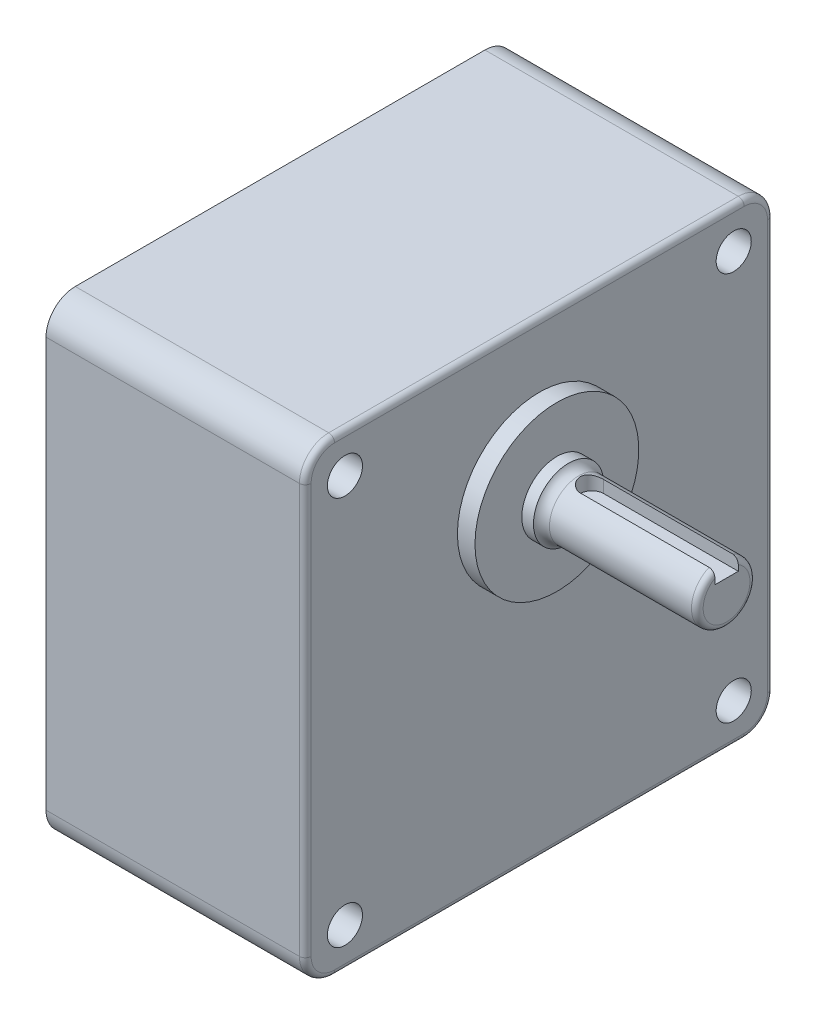
from build123d import *

# Parameters (mm, degrees)
SKETCH1_W           = 80
SKETCH1_H           = 80
BOSS_EXTRUDE1_DEPTH = 44.3
SKETCH2_R           = 3
CUT_EXTRUDE1_DEPTH  = 82.1633538
FILLET1_R           = 5
FILLET2_R           = 1
FILLET3_R           = 1
CUT_EXTRUDE2_DEPTH  = 25
FILLET4_R           = 2
SKETCH5_W           = 3
SKETCH5_H           = 36.5


with BuildPart() as part:
    # Sketch1 → Boss-Extrude1 (new body)
    with BuildSketch(Plane(origin=(-5, 0, 0), x_dir=(0, 0, -1), z_dir=(1, 0, 0))):
        with Locations((0, -15)):
            Rectangle(SKETCH1_W, SKETCH1_H)
    extrude(amount=-BOSS_EXTRUDE1_DEPTH)

    # Sketch2 → Cut-Extrude1 (cut, through all)
    with BuildSketch(Plane(origin=(-5, 0, 0), x_dir=(0, 0, -1), z_dir=(1, 0, 0))):
        with Locations((-33.218029743, 18.25)):
            Circle(SKETCH2_R)
        with Locations((33.218029743, 18.25)):
            Circle(SKETCH2_R)
        with Locations((33.218029743, -48.25)):
            Circle(SKETCH2_R)
        with Locations((-33.218029743, -48.25)):
            Circle(SKETCH2_R)
    extrude(amount=-CUT_EXTRUDE1_DEPTH, mode=Mode.SUBTRACT)

    # Fillet1
    fillet1_edges = [part.edges().sort_by_distance(p)[0] for p in [
        (-27.15, 25, 40),
        (-27.15, 25, -40),
        (-27.15, -55, -40),
        (-27.15, -55, 40),
    ]]
    fillet(fillet1_edges, radius=FILLET1_R)

    # Fillet2
    fillet2_edges = [part.edges().sort_by_distance(p)[0] for p in [
        (-5, -55, 0),
        (-5, -15, 40),
        (-5, -15, -40),
        (-5, 25, 0),
        (-5, 23.535533906, -38.535533906),
        (-5, 23.535533906, 38.535533906),
        (-5, -53.535533906, 38.535533906),
        (-5, -53.535533906, -38.535533906),
    ]]
    fillet(fillet2_edges, radius=FILLET2_R)

    # Sketch3 → Revolve1 (revolve)
    with BuildSketch(Plane.XY, mode=Mode.PRIVATE) as revolve1_sk:
        with BuildLine():
            Line((-5, 14), (-2, 14))
            Line((-2, 14), (-2, 6))
            Line((-2, 6), (0, 6))
            ThreePointArc((0, 6), (0.732050808, 5.267949192), (1.732050808, 5))
            Line((1.732050808, 5), (27, 5))
            Line((27, 5), (27, 0))
            Line((27, 0), (-5, 0))
            Line((-5, 0), (-5, 14))
        make_face()
    revolve(revolve1_sk.sketch.rotate(Axis((-5, 0, 0), (1, 0, 0)), 90), axis=Axis((-5, 0, 0), (1, 0, 0)))

    # Fillet3
    fillet3_edges = [part.edges().sort_by_distance(p)[0] for p in [
        (27, 0, -5),
    ]]
    fillet(fillet3_edges, radius=FILLET3_R)

    # Sketch4 → Cut-Extrude2 (cut)
    with BuildSketch(Plane(origin=(27, 0, 0), x_dir=(0, 0, -1), z_dir=(1, 0, 0))):
        with BuildLine():
            Line((2, 4.582575695), (2, 2.5))
            Line((2, 2.5), (-2, 2.5))
            Line((-2, 2.5), (-2, 4.582575695))
            ThreePointArc((-2, 4.582575695), (0, 5), (2, 4.582575695))
        make_face()
    extrude(amount=-CUT_EXTRUDE2_DEPTH, mode=Mode.SUBTRACT)

    # Fillet4
    fillet4_edges = [part.edges().sort_by_distance(p)[0] for p in [
        (2, 3.541287847, -2),
        (2, 3.541287847, 2),
    ]]
    fillet(fillet4_edges, radius=FILLET4_R - 0.0001)  # a hair under: the kernel refuses the full size

    # Sketch5 → Cut-Revolve1 (revolve, cut)
    with BuildSketch(Plane.XY):
        with Locations((-47.8, 3.25)):
            Rectangle(SKETCH5_W, SKETCH5_H)
    revolve(axis=Axis((-46.3, -15, 0), (-1, 0, 0)), mode=Mode.SUBTRACT)


solid = part.part
